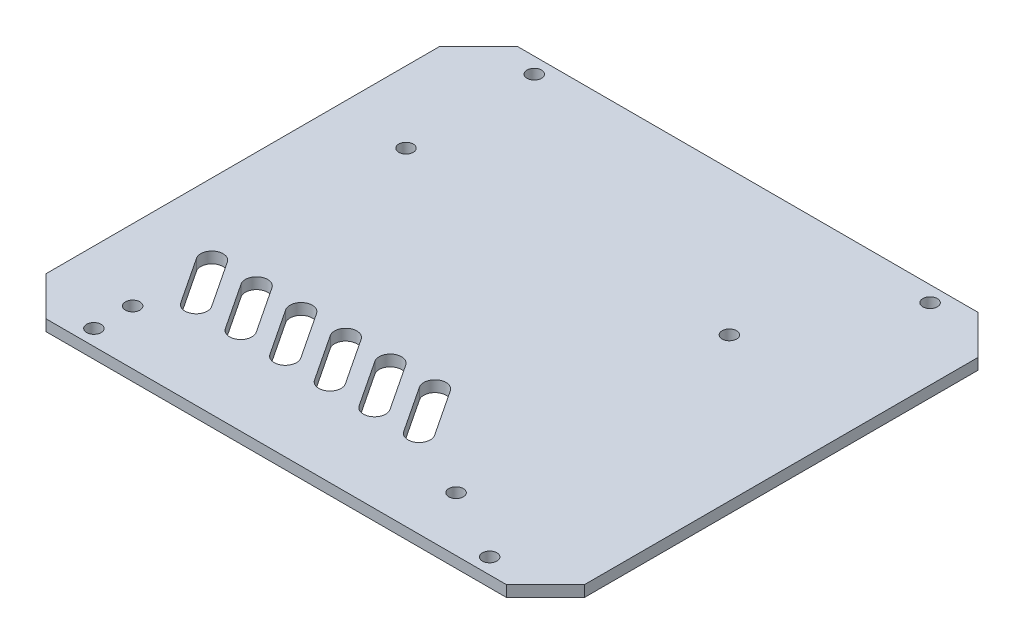
from build123d import *

# Parameters (mm, degrees)
EXTRUDE_1_DEPTH     = 2
CUT_EXTRUDE_1_REACH = 74.231
SKETCH_2_R          = 1.3
CUT_EXTRUDE_2_REACH = 74.231
SKETCH_3_R          = 1.3
CUT_EXTRUDE_3_REACH = 74.231


with BuildPart() as part:
    # 草图1 → 凸台-拉伸1 (new body)
    with BuildSketch(Plane.XZ.offset(18.39)):
        Polygon((-51.8, -43.295836944), (-44.795836944, -50.3), (37.795836944, -50.3), (44.8, -43.295836944), (44.8, 27.295836944), (37.795836944, 34.3), (-44.795836944, 34.3), (-51.8, 27.295836944), align=None)
    extrude(amount=EXTRUDE_1_DEPTH)

    # 草图2 → 切除-拉伸1 (cut, up to next)
    with BuildSketch(Plane.XZ.offset(20.39), mode=Mode.PRIVATE) as cut_extrude_1_sk1:
        with Locations((-39.011567772, -24.5)):
            Circle(SKETCH_2_R)
    cut_extrude_1_tool1 = extrude(cut_extrude_1_sk1.sketch, amount=-CUT_EXTRUDE_1_REACH, mode=Mode.PRIVATE) & part.part
    # 草图2 → 切除-拉伸1 (cut, up to next)
    with BuildSketch(Plane.XZ.offset(20.39), mode=Mode.PRIVATE) as cut_extrude_1_sk2:
        with Locations((19, -24.5)):
            Circle(SKETCH_2_R)
    cut_extrude_1_tool2 = extrude(cut_extrude_1_sk2.sketch, amount=-CUT_EXTRUDE_1_REACH, mode=Mode.PRIVATE) & part.part
    # 草图2 → 切除-拉伸1 (cut, up to next)
    with BuildSketch(Plane.XZ.offset(20.39), mode=Mode.PRIVATE) as cut_extrude_1_sk3:
        with Locations((-39.011567772, 24.535212594)):
            Circle(SKETCH_2_R)
    cut_extrude_1_tool3 = extrude(cut_extrude_1_sk3.sketch, amount=-CUT_EXTRUDE_1_REACH, mode=Mode.PRIVATE) & part.part
    # 草图2 → 切除-拉伸1 (cut, up to next)
    with BuildSketch(Plane.XZ.offset(20.39), mode=Mode.PRIVATE) as cut_extrude_1_sk4:
        with Locations((19, 24.535212594)):
            Circle(SKETCH_2_R)
    cut_extrude_1_tool4 = extrude(cut_extrude_1_sk4.sketch, amount=-CUT_EXTRUDE_1_REACH, mode=Mode.PRIVATE) & part.part
    add(cut_extrude_1_tool1.solids().sort_by_distance((-39.011568, -20.39, -24.5))[0], mode=Mode.SUBTRACT)
    add(cut_extrude_1_tool2.solids().sort_by_distance((19, -20.39, -24.5))[0], mode=Mode.SUBTRACT)
    add(cut_extrude_1_tool3.solids().sort_by_distance((-39.011568, -20.39, 24.535213))[0], mode=Mode.SUBTRACT)
    add(cut_extrude_1_tool4.solids().sort_by_distance((19, -20.39, 24.535213))[0], mode=Mode.SUBTRACT)

    # 草图3 → 切除-拉伸2 (cut, up to next)
    with BuildSketch(Plane.XZ.offset(20.39), mode=Mode.PRIVATE) as cut_extrude_2_sk1:
        with Locations((32, -47.5)):
            Circle(SKETCH_3_R)
    cut_extrude_2_tool1 = extrude(cut_extrude_2_sk1.sketch, amount=-CUT_EXTRUDE_2_REACH, mode=Mode.PRIVATE) & part.part
    # 草图3 → 切除-拉伸2 (cut, up to next)
    with BuildSketch(Plane.XZ.offset(20.39), mode=Mode.PRIVATE) as cut_extrude_2_sk2:
        with Locations((-39, -47.5)):
            Circle(SKETCH_3_R)
    cut_extrude_2_tool2 = extrude(cut_extrude_2_sk2.sketch, amount=-CUT_EXTRUDE_2_REACH, mode=Mode.PRIVATE) & part.part
    # 草图3 → 切除-拉伸2 (cut, up to next)
    with BuildSketch(Plane.XZ.offset(20.39), mode=Mode.PRIVATE) as cut_extrude_2_sk3:
        with Locations((32, 31.5)):
            Circle(SKETCH_3_R)
    cut_extrude_2_tool3 = extrude(cut_extrude_2_sk3.sketch, amount=-CUT_EXTRUDE_2_REACH, mode=Mode.PRIVATE) & part.part
    # 草图3 → 切除-拉伸2 (cut, up to next)
    with BuildSketch(Plane.XZ.offset(20.39), mode=Mode.PRIVATE) as cut_extrude_2_sk4:
        with Locations((-39, 31.5)):
            Circle(SKETCH_3_R)
    cut_extrude_2_tool4 = extrude(cut_extrude_2_sk4.sketch, amount=-CUT_EXTRUDE_2_REACH, mode=Mode.PRIVATE) & part.part
    add(cut_extrude_2_tool1.solids().sort_by_distance((32, -20.39, -47.5))[0], mode=Mode.SUBTRACT)
    add(cut_extrude_2_tool2.solids().sort_by_distance((-39, -20.39, -47.5))[0], mode=Mode.SUBTRACT)
    add(cut_extrude_2_tool3.solids().sort_by_distance((32, -20.39, 31.5))[0], mode=Mode.SUBTRACT)
    add(cut_extrude_2_tool4.solids().sort_by_distance((-39, -20.39, 31.5))[0], mode=Mode.SUBTRACT)

    # 草图4 → 切除-拉伸3 (cut, up to next)
    with BuildSketch(Plane.XZ.offset(20.39), mode=Mode.PRIVATE) as cut_extrude_3_sk1:
        with BuildLine():
            Line((-40.69671065, 11.402772719), (-35.182847057, 19.74527284))
            ThreePointArc((-35.182847057, 19.74527284), (-32.411574314, 20.311000146), (-31.845847008, 17.539727403))
            Line((-31.845847008, 17.539727403), (-37.359710601, 9.197227281))
            ThreePointArc((-37.359710601, 9.197227281), (-40.130983344, 8.631499976), (-40.69671065, 11.402772719))
        make_face()
    cut_extrude_3_tool1 = extrude(cut_extrude_3_sk1.sketch, amount=-CUT_EXTRUDE_3_REACH, mode=Mode.PRIVATE) & part.part
    # 草图4 → 切除-拉伸3 (cut, up to next)
    with BuildSketch(Plane.XZ.offset(20.39), mode=Mode.PRIVATE) as cut_extrude_3_sk2:
        with BuildLine():
            Line((-32.69671065, 11.402772719), (-27.182847057, 19.74527284))
            ThreePointArc((-27.182847057, 19.74527284), (-24.411574314, 20.311000146), (-23.845847008, 17.539727403))
            Line((-23.845847008, 17.539727403), (-29.359710601, 9.197227281))
            ThreePointArc((-29.359710601, 9.197227281), (-32.130983344, 8.631499976), (-32.69671065, 11.402772719))
        make_face()
    cut_extrude_3_tool2 = extrude(cut_extrude_3_sk2.sketch, amount=-CUT_EXTRUDE_3_REACH, mode=Mode.PRIVATE) & part.part
    # 草图4 → 切除-拉伸3 (cut, up to next)
    with BuildSketch(Plane.XZ.offset(20.39), mode=Mode.PRIVATE) as cut_extrude_3_sk3:
        with BuildLine():
            Line((-24.69671065, 11.402772719), (-19.182847057, 19.74527284))
            ThreePointArc((-19.182847057, 19.74527284), (-16.411574314, 20.311000146), (-15.845847008, 17.539727403))
            Line((-15.845847008, 17.539727403), (-21.359710601, 9.197227281))
            ThreePointArc((-21.359710601, 9.197227281), (-24.130983344, 8.631499976), (-24.69671065, 11.402772719))
        make_face()
    cut_extrude_3_tool3 = extrude(cut_extrude_3_sk3.sketch, amount=-CUT_EXTRUDE_3_REACH, mode=Mode.PRIVATE) & part.part
    # 草图4 → 切除-拉伸3 (cut, up to next)
    with BuildSketch(Plane.XZ.offset(20.39), mode=Mode.PRIVATE) as cut_extrude_3_sk4:
        with BuildLine():
            Line((-16.69671065, 11.402772719), (-11.182847057, 19.74527284))
            ThreePointArc((-11.182847057, 19.74527284), (-8.411574314, 20.311000146), (-7.845847008, 17.539727403))
            Line((-7.845847008, 17.539727403), (-13.359710601, 9.197227281))
            ThreePointArc((-13.359710601, 9.197227281), (-16.130983344, 8.631499976), (-16.69671065, 11.402772719))
        make_face()
    cut_extrude_3_tool4 = extrude(cut_extrude_3_sk4.sketch, amount=-CUT_EXTRUDE_3_REACH, mode=Mode.PRIVATE) & part.part
    # 草图4 → 切除-拉伸3 (cut, up to next)
    with BuildSketch(Plane.XZ.offset(20.39), mode=Mode.PRIVATE) as cut_extrude_3_sk5:
        with BuildLine():
            Line((-8.69671065, 11.402772719), (-3.182847057, 19.74527284))
            ThreePointArc((-3.182847057, 19.74527284), (-0.411574314, 20.311000146), (0.154152992, 17.539727403))
            Line((0.154152992, 17.539727403), (-5.359710601, 9.197227281))
            ThreePointArc((-5.359710601, 9.197227281), (-8.130983344, 8.631499976), (-8.69671065, 11.402772719))
        make_face()
    cut_extrude_3_tool5 = extrude(cut_extrude_3_sk5.sketch, amount=-CUT_EXTRUDE_3_REACH, mode=Mode.PRIVATE) & part.part
    # 草图4 → 切除-拉伸3 (cut, up to next)
    with BuildSketch(Plane.XZ.offset(20.39), mode=Mode.PRIVATE) as cut_extrude_3_sk6:
        with BuildLine():
            Line((-0.69671065, 11.402772719), (4.817152943, 19.74527284))
            ThreePointArc((4.817152943, 19.74527284), (7.588425686, 20.311000146), (8.154152992, 17.539727403))
            Line((8.154152992, 17.539727403), (2.640289399, 9.197227281))
            ThreePointArc((2.640289399, 9.197227281), (-0.130983344, 8.631499976), (-0.69671065, 11.402772719))
        make_face()
    cut_extrude_3_tool6 = extrude(cut_extrude_3_sk6.sketch, amount=-CUT_EXTRUDE_3_REACH, mode=Mode.PRIVATE) & part.part
    add(cut_extrude_3_tool1.solids().sort_by_distance((-36.271279, -20.39, 14.47125))[0], mode=Mode.SUBTRACT)
    add(cut_extrude_3_tool2.solids().sort_by_distance((-28.271279, -20.39, 14.47125))[0], mode=Mode.SUBTRACT)
    add(cut_extrude_3_tool3.solids().sort_by_distance((-20.271279, -20.39, 14.47125))[0], mode=Mode.SUBTRACT)
    add(cut_extrude_3_tool4.solids().sort_by_distance((-12.271279, -20.39, 14.47125))[0], mode=Mode.SUBTRACT)
    add(cut_extrude_3_tool5.solids().sort_by_distance((-4.271279, -20.39, 14.47125))[0], mode=Mode.SUBTRACT)
    add(cut_extrude_3_tool6.solids().sort_by_distance((3.728721, -20.39, 14.47125))[0], mode=Mode.SUBTRACT)


solid = part.part
